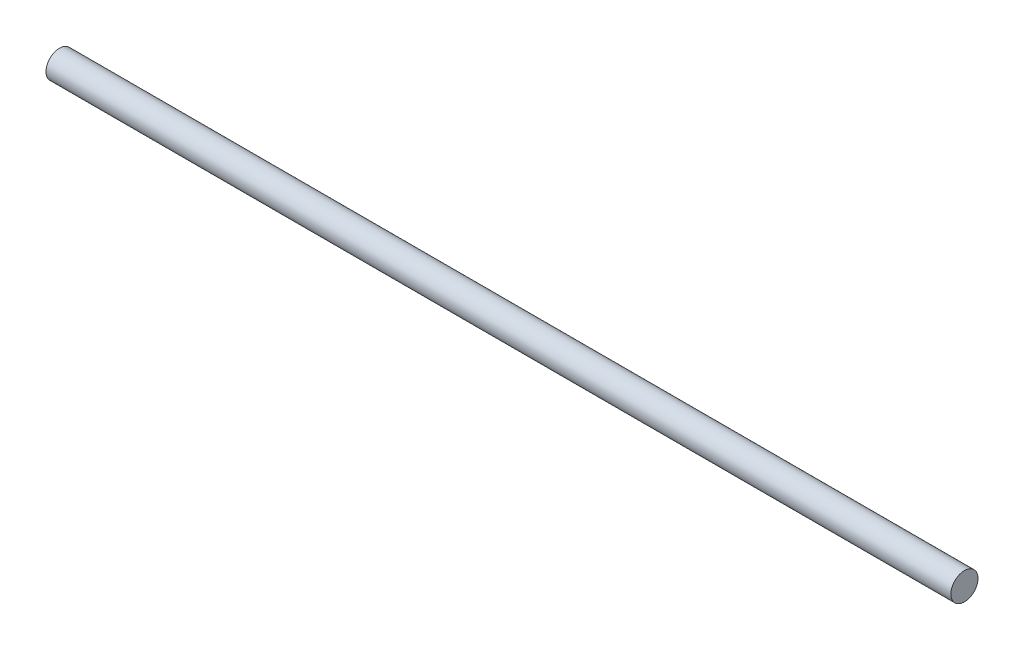
from build123d import *

# Parameters (mm, degrees)
SKETCH_1_R      = 1.5
EXTRUDE_1_DEPTH = 100


with BuildPart() as part:
    # 草图1 → 凸台-拉伸1 (new body)
    with BuildSketch(Plane(origin=(0, 0, 0), x_dir=(0, 0, -1), z_dir=(1, 0, 0))):
        Circle(SKETCH_1_R)
    extrude(amount=EXTRUDE_1_DEPTH)


solid = part.part
